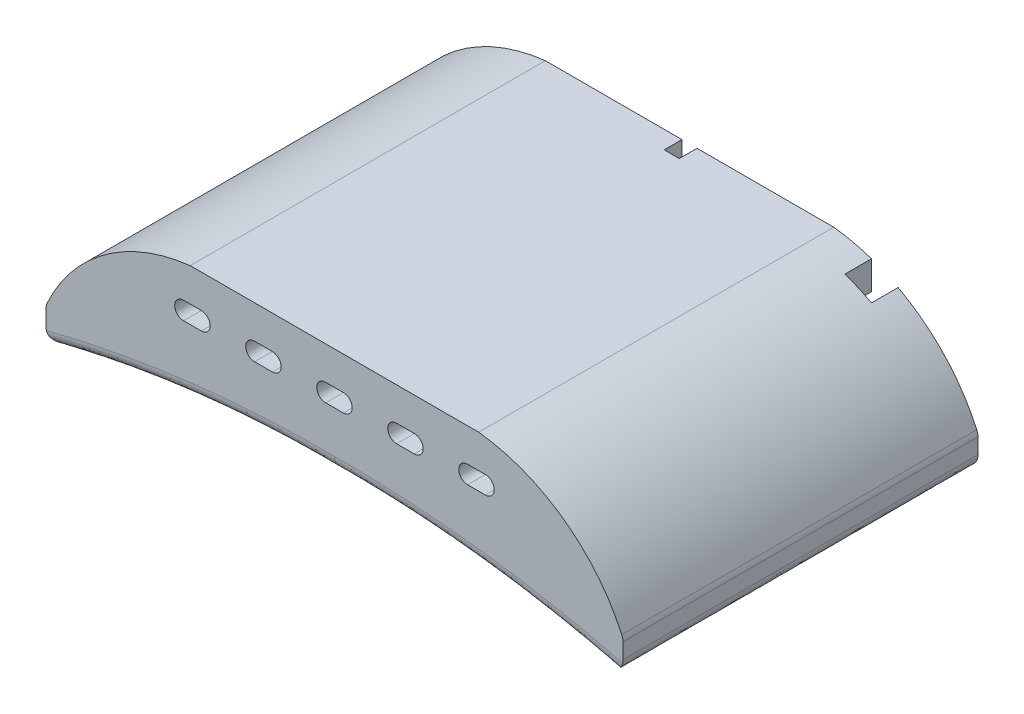
from build123d import *

# Parameters (mm, degrees)
DEPTH_OF_PIECE_DEPTH    = 40
CUT_EXTRUDE3_DEPTH      = 38
WIRING_HOLES_DEPTH      = 78.259303647
WIRING_HOLES_DEPTH_BACK = 78.259303647
VARFILLET2_R            = 1.5
SKETCH17_W              = 1.7
SKETCH17_H              = 14.087818553
CUT_EXTRUDE7_DEPTH      = 2
SKETCH18_W              = 3
SKETCH18_H              = 5.555456181
CUT_EXTRUDE8_DEPTH      = 3


with BuildPart() as part:
    # Dimensions of insert peice → Depth of piece (new body)
    with BuildSketch(Plane.XY):
        with BuildLine():
            Line((0, -4), (0, 0))
            ThreePointArc((0, 0), (-6.517304845, 8.177087189), (-16.25, 12))
            Line((-16.25, 12), (-48.75, 12))
            ThreePointArc((-48.75, 12), (-58.482695155, 8.177087189), (-65, 0))
            Line((-65, 0), (-65, -4))
            ThreePointArc((-65, -4), (-48.881086926, -0.934918729), (-32.5, 0))
            ThreePointArc((-32.5, 0), (-16.118913074, -0.934918729), (0, -4))
        make_face()
    extrude(amount=DEPTH_OF_PIECE_DEPTH)

    # Sketch13 → Cut-Extrude3 (cut)
    with BuildSketch(Plane(origin=(0, 0, 0), x_dir=(-1, 0, 0), z_dir=(0, 0, -1))):
        Polygon((5.5, 1.5), (59.5, 1.5), (59.5, 4.5), (48.75, 10), (16.25, 10), (5.5, 4.5), align=None)
    extrude(amount=-CUT_EXTRUDE3_DEPTH, mode=Mode.SUBTRACT)

    # Sketch15 → Wiring Holes (cut, two sides: drawn at the far end of the back side and taken through both)
    with BuildSketch(Plane(origin=(0, 0, 0), x_dir=(-1, 0, 0), z_dir=(0, 0, -1)).offset(-WIRING_HOLES_DEPTH_BACK)):
        with BuildLine():
            Line((31.5, 8.25), (33.5, 8.25))
            ThreePointArc((33.5, 8.25), (34.5, 7.25), (33.5, 6.25))
            Line((33.5, 6.25), (31.5, 6.25))
            ThreePointArc((31.5, 6.25), (30.5, 7.25), (31.5, 8.25))
        make_face()
        with BuildLine():
            Line((23.5, 8.25), (25.5, 8.25))
            ThreePointArc((25.5, 8.25), (26.5, 7.25), (25.5, 6.25))
            Line((25.5, 6.25), (23.5, 6.25))
            ThreePointArc((23.5, 6.25), (22.5, 7.25), (23.5, 8.25))
        make_face()
        with BuildLine():
            Line((15.5, 8.25), (17.5, 8.25))
            ThreePointArc((17.5, 8.25), (18.5, 7.25), (17.5, 6.25))
            Line((17.5, 6.25), (15.5, 6.25))
            ThreePointArc((15.5, 6.25), (14.5, 7.25), (15.5, 8.25))
        make_face()
        with BuildLine():
            Line((49.5, 8.25), (47.5, 8.25))
            ThreePointArc((47.5, 8.25), (46.5, 7.25), (47.5, 6.25))
            Line((47.5, 6.25), (49.5, 6.25))
            ThreePointArc((49.5, 6.25), (50.5, 7.25), (49.5, 8.25))
        make_face()
        with BuildLine():
            Line((41.5, 8.25), (39.5, 8.25))
            ThreePointArc((39.5, 8.25), (38.5, 7.25), (39.5, 6.25))
            Line((39.5, 6.25), (41.5, 6.25))
            ThreePointArc((41.5, 6.25), (42.5, 7.25), (41.5, 8.25))
        make_face()
    extrude(amount=WIRING_HOLES_DEPTH + WIRING_HOLES_DEPTH_BACK, mode=Mode.SUBTRACT)

    # VarFillet2
    varfillet2_edges = [part.edges().sort_by_distance(p)[0] for p in [
        (-65, 0, 20),
        (-65, -4, 20),
        (-48.881086926, -0.934918729, 40),
        (-16.118913074, -0.934918729, 40),
        (0, 0, 20),
        (0, -4, 20),
    ]]
    fillet(varfillet2_edges, radius=VARFILLET2_R)

    # Sketch17 → Cut-Extrude7 (cut)
    with BuildSketch(Plane(origin=(0, 0, 0), x_dir=(-1, 0, 0), z_dir=(0, 0, -1))):
        with Locations((32.5, 6.081256838)):
            Rectangle(SKETCH17_W, SKETCH17_H)
    extrude(amount=-CUT_EXTRUDE7_DEPTH, mode=Mode.SUBTRACT)

    # Sketch18 → Cut-Extrude8 (cut)
    with BuildSketch(Plane(origin=(0, 0, 0), x_dir=(-1, 0, 0), z_dir=(0, 0, -1))):
        with Locations((10.5, 8.761996077)):
            Rectangle(SKETCH18_W, SKETCH18_H)
    extrude(amount=-CUT_EXTRUDE8_DEPTH, mode=Mode.SUBTRACT)


solid = part.part
